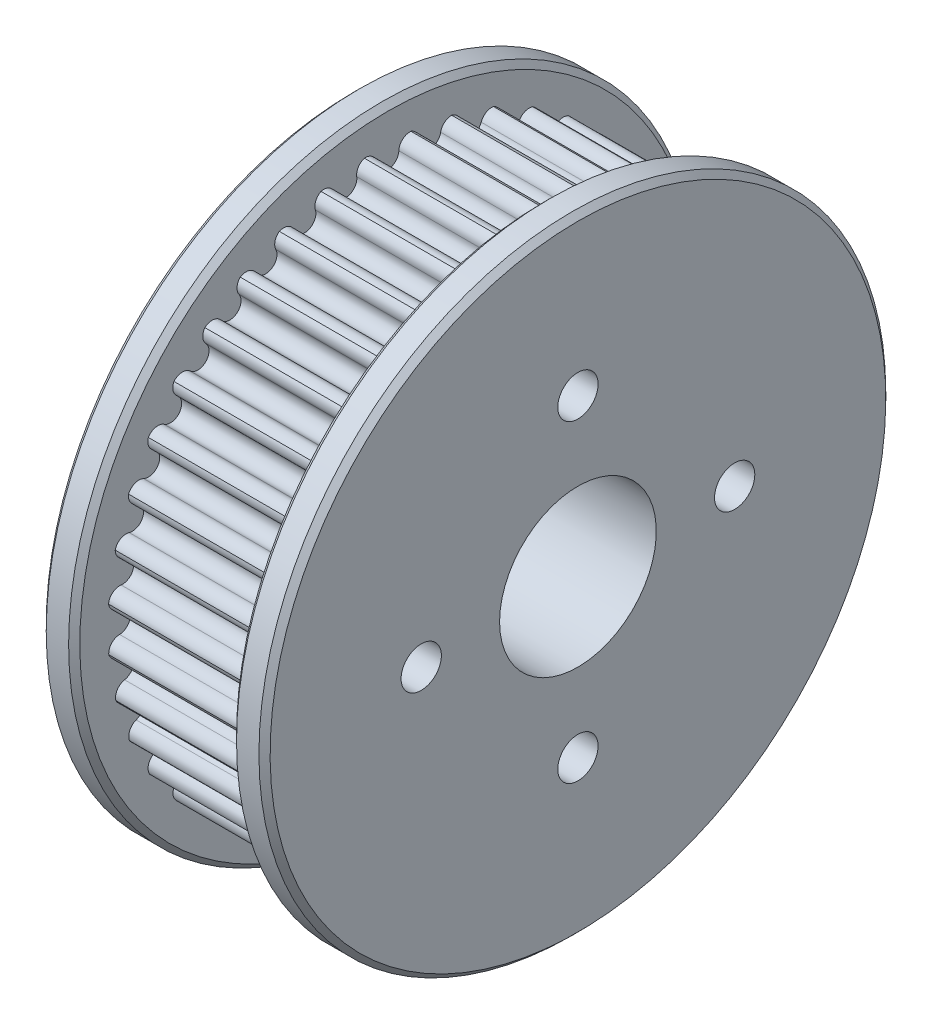
from build123d import *

# Parameters (mm, degrees)
CUT_EXTRUDE1_START       = -16.5
CUT_EXTRUDE1_OUTLINE_R   = 4
CUT_EXTRUDE1_DEPTH       = 9.5
CUT_EXTRUDE1_START_2     = -16.75
CUT_EXTRUDE1_2_OUTLINE_R = 14
CUT_EXTRUDE1_2_DEPTH     = 1
CUT_EXTRUDE1_START_3     = -8.25
CUT_EXTRUDE1_3_OUTLINE_R = 14
CUT_EXTRUDE1_3_DEPTH     = 1
SKETCH2_R                = 6.324330015
BOSS_EXTRUDE1_DEPTH      = 10
CUT_EXTRUDE2_REACH       = 24.181
SKETCH5_R                = 0.9
SKETCH6_R                = 5
BOSS_EXTRUDE3_DEPTH      = 2.75
SKETCH7_R                = 3.5
CUT_EXTRUDE3_DEPTH       = 24.549150728
FILLET1_R                = 1


with BuildPart() as part:
    # Cut-Extrude1: read off the stored shape, not the designer's step
    # Cut-Extrude1 outline → Cut-Extrude1 (new body)
    with BuildSketch(Plane(origin=(17, 0, 0), x_dir=(0, 0, -1), z_dir=(1, 0, 0)).offset(CUT_EXTRUDE1_START)):
        with BuildLine():
            ThreePointArc((1.041143378, 12.456565356), (0.66686285, 12.331604355), (0.499748821, 11.974149369))
            ThreePointArc((0.499748821, 11.974149369), (0, 11.489995997), (-0.499748821, 11.974149369))
            ThreePointArc((-0.499748821, 11.974149369), (-0.66686285, 12.331604355), (-1.041143378, 12.456565356))
            ThreePointArc((-1.041143378, 12.456565356), (-1.309730051, 12.245866404), (-1.380507466, 11.9119152))
            ThreePointArc((-1.380507466, 11.9119152), (-1.793941124, 11.349100539), (-2.366765735, 11.748549781))
            ThreePointArc((-2.366765735, 11.748549781), (-2.587740592, 12.075461509), (-2.976961313, 12.140333659))
            ThreePointArc((-2.976961313, 12.140333659), (-3.20928066, 11.890212548), (-3.226945211, 11.54930081))
            ThreePointArc((-3.226945211, 11.54930081), (-3.547245203, 10.928740058), (-4.175505021, 11.233661906))
            ThreePointArc((-4.175505021, 11.233661906), (-4.444899572, 11.521980725), (-4.83947658, 11.525166655))
            ThreePointArc((-4.83947658, 11.525166655), (-5.029808129, 11.241782197), (-4.993924854, 10.902304304))
            ThreePointArc((-4.993924854, 10.902304304), (-5.213204333, 10.239277727), (-5.881429516, 10.442163992))
            ThreePointArc((-5.881429516, 10.442163992), (-6.192610373, 10.684790536), (-6.582827873, 10.626211799))
            ThreePointArc((-6.582827873, 10.626211799), (-6.726485029, 10.31654186), (-6.637937494, 9.986856884))
            ThreePointArc((-6.637937494, 9.986856884), (-6.750797071, 9.297690396), (-7.442533697, 9.393545346))
            ThreePointArc((-7.442533697, 9.393545346), (-7.787838555, 9.584505343), (-8.164088097, 9.465604342))
            ThreePointArc((-8.164088097, 9.465604342), (-8.257533543, 9.137274024), (-8.118502082, 8.825499903))
            ThreePointArc((-8.118502082, 8.825499903), (-8.122162779, 8.127163071), (-8.820377998, 8.113626438))
            ThreePointArc((-8.820377998, 8.113626438), (-9.191304305, 8.248217819), (-9.544321376, 8.071922291))
            ThreePointArc((-9.544321376, 8.071922291), (-9.585254176, 7.733016176), (-9.399162206, 7.446829824))
            ThreePointArc((-9.399162206, 7.446829824), (-9.293533885, 6.756518017), (-9.98103532, 6.633923119))
            ThreePointArc((-9.98103532, 6.633923119), (-10.36844964, 6.708831799), (-10.689541787, 6.479482724))
            ThreePointArc((-10.689541787, 6.479482724), (-10.67695404, 6.138345804), (-10.448383761, 5.88479408))
            ThreePointArc((-10.448383761, 5.88479408), (-10.236067343, 5.219505067), (-10.895926427, 4.990870596))
            ThreePointArc((-10.895926427, 4.990870596), (-11.290289332, 5.004252074), (-11.571550203, 4.727496789))
            ThreePointArc((-11.571550203, 4.727496789), (-11.50575186, 4.392528988), (-11.240331433, 4.177855175))
            ThreePointArc((-11.240331433, 4.177855175), (-10.926554851, 3.55397058), (-11.542523663, 3.224926275))
            ThreePointArc((-11.542523663, 3.224926275), (-11.934124632, 3.176451055), (-12.16862865, 2.859104193))
            ThreePointArc((-12.16862865, 2.859104193), (-12.051239885, 2.53855353), (-11.75550484, 2.368043611))
            ThreePointArc((-11.75550484, 2.368043611), (-11.347994316, 1.800925542), (-11.90490566, 1.379573567))
            ThreePointArc((-11.90490566, 1.379573567), (-12.284102175, 1.270435269), (-12.466075073, 0.920310963))
            ThreePointArc((-12.466075073, 0.920310963), (-12.299986388, 0.622070459), (-11.981218704, 0.499922953))
            ThreePointArc((-11.981218704, 0.499922953), (-11.490008498, 0.00353574), (-11.974149369, -0.499748821))
            ThreePointArc((-11.974149369, -0.499748821), (-12.331604355, -0.66686285), (-12.456565356, -1.041143378))
            ThreePointArc((-12.456565356, -1.041143378), (-12.245866404, -1.309730051), (-11.9119152, -1.380507466))
            ThreePointArc((-11.9119152, -1.380507466), (-11.349100539, -1.793941124), (-11.748549781, -2.366765735))
            ThreePointArc((-11.748549781, -2.366765735), (-12.075461509, -2.587740592), (-12.140333659, -2.976961313))
            ThreePointArc((-12.140333659, -2.976961313), (-11.890212548, -3.20928066), (-11.54930081, -3.226945211))
            ThreePointArc((-11.54930081, -3.226945211), (-10.928740058, -3.547245203), (-11.233661906, -4.175505021))
            ThreePointArc((-11.233661906, -4.175505021), (-11.521980725, -4.444899572), (-11.525166655, -4.83947658))
            ThreePointArc((-11.525166655, -4.83947658), (-11.241782197, -5.029808129), (-10.902304304, -4.993924854))
            ThreePointArc((-10.902304304, -4.993924854), (-10.239277727, -5.213204333), (-10.442163992, -5.881429516))
            ThreePointArc((-10.442163992, -5.881429516), (-10.684790536, -6.192610373), (-10.626211799, -6.582827873))
            ThreePointArc((-10.626211799, -6.582827873), (-10.31654186, -6.726485029), (-9.986856884, -6.637937494))
            ThreePointArc((-9.986856884, -6.637937494), (-9.297690396, -6.750797071), (-9.393545346, -7.442533697))
            ThreePointArc((-9.393545346, -7.442533697), (-9.584505343, -7.787838555), (-9.465604342, -8.164088097))
            ThreePointArc((-9.465604342, -8.164088097), (-9.137274024, -8.257533543), (-8.825499903, -8.118502082))
            ThreePointArc((-8.825499903, -8.118502082), (-8.127163071, -8.122162779), (-8.113626438, -8.820377998))
            ThreePointArc((-8.113626438, -8.820377998), (-8.248217819, -9.191304305), (-8.071922291, -9.544321376))
            ThreePointArc((-8.071922291, -9.544321376), (-7.733016176, -9.585254176), (-7.446829824, -9.399162206))
            ThreePointArc((-7.446829824, -9.399162206), (-6.756518017, -9.293533885), (-6.633923119, -9.98103532))
            ThreePointArc((-6.633923119, -9.98103532), (-6.708831799, -10.36844964), (-6.479482724, -10.689541787))
            ThreePointArc((-6.479482724, -10.689541787), (-6.138345804, -10.67695404), (-5.88479408, -10.448383761))
            ThreePointArc((-5.88479408, -10.448383761), (-5.219505067, -10.236067343), (-4.990870596, -10.895926427))
            ThreePointArc((-4.990870596, -10.895926427), (-5.004252074, -11.290289332), (-4.727496789, -11.571550203))
            ThreePointArc((-4.727496789, -11.571550203), (-4.392528988, -11.50575186), (-4.177855175, -11.240331433))
            ThreePointArc((-4.177855175, -11.240331433), (-3.55397058, -10.926554851), (-3.224926275, -11.542523663))
            ThreePointArc((-3.224926275, -11.542523663), (-3.176451055, -11.934124632), (-2.859104193, -12.16862865))
            ThreePointArc((-2.859104193, -12.16862865), (-2.53855353, -12.051239885), (-2.368043611, -11.75550484))
            ThreePointArc((-2.368043611, -11.75550484), (-1.800925542, -11.347994316), (-1.379573567, -11.90490566))
            ThreePointArc((-1.379573567, -11.90490566), (-1.270435269, -12.284102175), (-0.920310963, -12.466075073))
            ThreePointArc((-0.920310963, -12.466075073), (-0.622070459, -12.299986388), (-0.499922953, -11.981218704))
            ThreePointArc((-0.499922953, -11.981218704), (-0.00353574, -11.490008498), (0.499748821, -11.974149369))
            ThreePointArc((0.499748821, -11.974149369), (0.66686285, -12.331604355), (1.041143378, -12.456565356))
            ThreePointArc((1.041143378, -12.456565356), (1.309730051, -12.245866404), (1.380507466, -11.9119152))
            ThreePointArc((1.380507466, -11.9119152), (1.793941124, -11.349100539), (2.366765735, -11.748549781))
            ThreePointArc((2.366765735, -11.748549781), (2.587740592, -12.075461509), (2.976961313, -12.140333659))
            ThreePointArc((2.976961313, -12.140333659), (3.20928066, -11.890212548), (3.226945211, -11.54930081))
            ThreePointArc((3.226945211, -11.54930081), (3.547245203, -10.928740058), (4.175505021, -11.233661906))
            ThreePointArc((4.175505021, -11.233661906), (4.444899572, -11.521980725), (4.83947658, -11.525166655))
            ThreePointArc((4.83947658, -11.525166655), (5.029808129, -11.241782197), (4.993924854, -10.902304304))
            ThreePointArc((4.993924854, -10.902304304), (5.213204333, -10.239277727), (5.881429516, -10.442163992))
            ThreePointArc((5.881429516, -10.442163992), (6.192610373, -10.684790536), (6.582827873, -10.626211799))
            ThreePointArc((6.582827873, -10.626211799), (6.726485029, -10.31654186), (6.637937494, -9.986856884))
            ThreePointArc((6.637937494, -9.986856884), (6.750797071, -9.297690396), (7.442533697, -9.393545346))
            ThreePointArc((7.442533697, -9.393545346), (7.787838555, -9.584505343), (8.164088097, -9.465604342))
            ThreePointArc((8.164088097, -9.465604342), (8.257533543, -9.137274024), (8.118502082, -8.825499903))
            ThreePointArc((8.118502082, -8.825499903), (8.122162779, -8.127163071), (8.820377998, -8.113626438))
            ThreePointArc((8.820377998, -8.113626438), (9.191304305, -8.248217819), (9.544321376, -8.071922291))
            ThreePointArc((9.544321376, -8.071922291), (9.585254176, -7.733016176), (9.399162206, -7.446829824))
            ThreePointArc((9.399162206, -7.446829824), (9.293533885, -6.756518017), (9.98103532, -6.633923119))
            ThreePointArc((9.98103532, -6.633923119), (10.36844964, -6.708831799), (10.689541787, -6.479482724))
            ThreePointArc((10.689541787, -6.479482724), (10.67695404, -6.138345804), (10.448383761, -5.88479408))
            ThreePointArc((10.448383761, -5.88479408), (10.236067343, -5.219505067), (10.895926427, -4.990870596))
            ThreePointArc((10.895926427, -4.990870596), (11.290289332, -5.004252074), (11.571550203, -4.727496789))
            ThreePointArc((11.571550203, -4.727496789), (11.50575186, -4.392528988), (11.240331433, -4.177855175))
            ThreePointArc((11.240331433, -4.177855175), (10.926554851, -3.55397058), (11.542523663, -3.224926275))
            ThreePointArc((11.542523663, -3.224926275), (11.934124632, -3.176451055), (12.16862865, -2.859104193))
            ThreePointArc((12.16862865, -2.859104193), (12.051239885, -2.53855353), (11.75550484, -2.368043611))
            ThreePointArc((11.75550484, -2.368043611), (11.347994316, -1.800925542), (11.90490566, -1.379573567))
            ThreePointArc((11.90490566, -1.379573567), (12.284102175, -1.270435269), (12.466075073, -0.920310963))
            ThreePointArc((12.466075073, -0.920310963), (12.299986388, -0.622070459), (11.981218704, -0.499922953))
            ThreePointArc((11.981218704, -0.499922953), (11.490008498, -0.00353574), (11.974149369, 0.499748821))
            ThreePointArc((11.974149369, 0.499748821), (12.331604355, 0.66686285), (12.456565356, 1.041143378))
            ThreePointArc((12.456565356, 1.041143378), (12.245866404, 1.309730051), (11.9119152, 1.380507466))
            ThreePointArc((11.9119152, 1.380507466), (11.349100539, 1.793941124), (11.748549781, 2.366765735))
            ThreePointArc((11.748549781, 2.366765735), (12.075461509, 2.587740592), (12.140333659, 2.976961313))
            ThreePointArc((12.140333659, 2.976961313), (11.890212548, 3.20928066), (11.54930081, 3.226945211))
            ThreePointArc((11.54930081, 3.226945211), (10.928740058, 3.547245203), (11.233661906, 4.175505021))
            ThreePointArc((11.233661906, 4.175505021), (11.521980725, 4.444899572), (11.525166655, 4.83947658))
            ThreePointArc((11.525166655, 4.83947658), (11.241782197, 5.029808129), (10.902304304, 4.993924854))
            ThreePointArc((10.902304304, 4.993924854), (10.239277727, 5.213204333), (10.442163992, 5.881429516))
            ThreePointArc((10.442163992, 5.881429516), (10.684790536, 6.192610373), (10.626211799, 6.582827873))
            ThreePointArc((10.626211799, 6.582827873), (10.31654186, 6.726485029), (9.986856884, 6.637937494))
            ThreePointArc((9.986856884, 6.637937494), (9.297690396, 6.750797071), (9.393545346, 7.442533697))
            ThreePointArc((9.393545346, 7.442533697), (9.584505343, 7.787838555), (9.465604342, 8.164088097))
            ThreePointArc((9.465604342, 8.164088097), (9.137274024, 8.257533543), (8.825499903, 8.118502082))
            ThreePointArc((8.825499903, 8.118502082), (8.127163071, 8.122162779), (8.113626438, 8.820377998))
            ThreePointArc((8.113626438, 8.820377998), (8.248217819, 9.191304305), (8.071922291, 9.544321376))
            ThreePointArc((8.071922291, 9.544321376), (7.733016176, 9.585254176), (7.446829824, 9.399162206))
            ThreePointArc((7.446829824, 9.399162206), (6.756518017, 9.293533885), (6.633923119, 9.98103532))
            ThreePointArc((6.633923119, 9.98103532), (6.708831799, 10.36844964), (6.479482724, 10.689541787))
            ThreePointArc((6.479482724, 10.689541787), (6.138345804, 10.67695404), (5.88479408, 10.448383761))
            ThreePointArc((5.88479408, 10.448383761), (5.219505067, 10.236067343), (4.990870596, 10.895926427))
            ThreePointArc((4.990870596, 10.895926427), (5.004252074, 11.290289332), (4.727496789, 11.571550203))
            ThreePointArc((4.727496789, 11.571550203), (4.392528988, 11.50575186), (4.177855175, 11.240331433))
            ThreePointArc((4.177855175, 11.240331433), (3.55397058, 10.926554851), (3.224926275, 11.542523663))
            ThreePointArc((3.224926275, 11.542523663), (3.176451055, 11.934124632), (2.859104193, 12.16862865))
            ThreePointArc((2.859104193, 12.16862865), (2.53855353, 12.051239885), (2.368043611, 11.75550484))
            ThreePointArc((2.368043611, 11.75550484), (1.797431377, 11.34853508), (1.380507466, 11.9119152))
            ThreePointArc((1.380507466, 11.9119152), (1.309730051, 12.245866404), (1.041143378, 12.456565356))
        make_face()
        Circle(CUT_EXTRUDE1_OUTLINE_R, mode=Mode.SUBTRACT)
    extrude(amount=CUT_EXTRUDE1_DEPTH)

    # Cut-Extrude1 2 outline → Cut-Extrude1 2 (add)
    with BuildSketch(Plane(origin=(17, 0, 0), x_dir=(0, 0, -1), z_dir=(1, 0, 0)).offset(CUT_EXTRUDE1_START_2)):
        Circle(CUT_EXTRUDE1_2_OUTLINE_R)
        with BuildLine():
            ThreePointArc((-0.499748821, 11.974149369), (0, 11.489995997), (0.499748821, 11.974149369))
            ThreePointArc((0.499748821, 11.974149369), (0.66686285, 12.331604355), (1.041143378, 12.456565356))
            ThreePointArc((1.041143378, 12.456565356), (1.309730051, 12.245866404), (1.380507466, 11.9119152))
            ThreePointArc((1.380507466, 11.9119152), (1.797431377, 11.34853508), (2.368043611, 11.75550484))
            ThreePointArc((2.368043611, 11.75550484), (2.53855353, 12.051239885), (2.859104193, 12.16862865))
            ThreePointArc((2.859104193, 12.16862865), (3.176451055, 11.934124632), (3.224926275, 11.542523663))
            ThreePointArc((3.224926275, 11.542523663), (3.55397058, 10.926554851), (4.177855175, 11.240331433))
            ThreePointArc((4.177855175, 11.240331433), (4.392528988, 11.50575186), (4.727496789, 11.571550204))
            ThreePointArc((4.727496789, 11.571550204), (5.004252074, 11.290289332), (4.990870596, 10.895926427))
            ThreePointArc((4.990870596, 10.895926427), (5.219505067, 10.236067343), (5.88479408, 10.448383761))
            ThreePointArc((5.88479408, 10.448383761), (6.138345804, 10.67695404), (6.479482724, 10.689541788))
            ThreePointArc((6.479482724, 10.689541788), (6.708831799, 10.36844964), (6.633923119, 9.98103532))
            ThreePointArc((6.633923119, 9.98103532), (6.756518017, 9.293533885), (7.446829824, 9.399162206))
            ThreePointArc((7.446829824, 9.399162206), (7.733016176, 9.585254176), (8.071922291, 9.544321376))
            ThreePointArc((8.071922291, 9.544321376), (8.248217819, 9.191304305), (8.113626438, 8.820377998))
            ThreePointArc((8.113626438, 8.820377998), (8.127163071, 8.122162779), (8.825499903, 8.118502082))
            ThreePointArc((8.825499903, 8.118502082), (9.137274024, 8.257533543), (9.465604342, 8.164088097))
            ThreePointArc((9.465604342, 8.164088097), (9.584505343, 7.787838555), (9.393545346, 7.442533697))
            ThreePointArc((9.393545346, 7.442533697), (9.297690396, 6.750797071), (9.986856884, 6.637937494))
            ThreePointArc((9.986856884, 6.637937494), (10.31654186, 6.726485029), (10.626211799, 6.582827873))
            ThreePointArc((10.626211799, 6.582827873), (10.684790536, 6.192610373), (10.442163992, 5.881429516))
            ThreePointArc((10.442163992, 5.881429516), (10.239277727, 5.213204333), (10.902304304, 4.993924854))
            ThreePointArc((10.902304304, 4.993924854), (11.241782197, 5.029808129), (11.525166655, 4.83947658))
            ThreePointArc((11.525166655, 4.83947658), (11.521980725, 4.444899572), (11.233661906, 4.175505021))
            ThreePointArc((11.233661906, 4.175505021), (10.928740058, 3.547245203), (11.54930081, 3.226945211))
            ThreePointArc((11.54930081, 3.226945211), (11.890212548, 3.20928066), (12.140333659, 2.976961313))
            ThreePointArc((12.140333659, 2.976961313), (12.075461509, 2.587740592), (11.748549781, 2.366765735))
            ThreePointArc((11.748549781, 2.366765735), (11.349100539, 1.793941124), (11.9119152, 1.380507466))
            ThreePointArc((11.9119152, 1.380507466), (12.245866404, 1.309730051), (12.456565356, 1.041143378))
            ThreePointArc((12.456565356, 1.041143378), (12.331604355, 0.66686285), (11.974149369, 0.499748821))
            ThreePointArc((11.974149369, 0.499748821), (11.490008498, -0.00353574), (11.981218704, -0.499922953))
            ThreePointArc((11.981218704, -0.499922953), (12.299986388, -0.622070459), (12.466075073, -0.920310963))
            ThreePointArc((12.466075073, -0.920310963), (12.284102175, -1.270435269), (11.90490566, -1.379573567))
            ThreePointArc((11.90490566, -1.379573567), (11.347994316, -1.800925542), (11.75550484, -2.368043611))
            ThreePointArc((11.75550484, -2.368043611), (12.051239885, -2.53855353), (12.16862865, -2.859104193))
            ThreePointArc((12.16862865, -2.859104193), (11.934124632, -3.176451055), (11.542523663, -3.224926275))
            ThreePointArc((11.542523663, -3.224926275), (10.926554851, -3.55397058), (11.240331433, -4.177855175))
            ThreePointArc((11.240331433, -4.177855175), (11.50575186, -4.392528988), (11.571550204, -4.727496789))
            ThreePointArc((11.571550204, -4.727496789), (11.290289332, -5.004252074), (10.895926427, -4.990870596))
            ThreePointArc((10.895926427, -4.990870596), (10.236067343, -5.219505067), (10.448383761, -5.88479408))
            ThreePointArc((10.448383761, -5.88479408), (10.67695404, -6.138345804), (10.689541788, -6.479482724))
            ThreePointArc((10.689541788, -6.479482724), (10.36844964, -6.708831799), (9.98103532, -6.633923119))
            ThreePointArc((9.98103532, -6.633923119), (9.293533885, -6.756518017), (9.399162206, -7.446829824))
            ThreePointArc((9.399162206, -7.446829824), (9.585254176, -7.733016176), (9.544321376, -8.071922291))
            ThreePointArc((9.544321376, -8.071922291), (9.191304305, -8.248217819), (8.820377998, -8.113626438))
            ThreePointArc((8.820377998, -8.113626438), (8.122162779, -8.127163071), (8.118502082, -8.825499903))
            ThreePointArc((8.118502082, -8.825499903), (8.257533543, -9.137274024), (8.164088097, -9.465604342))
            ThreePointArc((8.164088097, -9.465604342), (7.787838555, -9.584505343), (7.442533697, -9.393545346))
            ThreePointArc((7.442533697, -9.393545346), (6.750797071, -9.297690396), (6.637937494, -9.986856884))
            ThreePointArc((6.637937494, -9.986856884), (6.726485029, -10.31654186), (6.582827873, -10.626211799))
            ThreePointArc((6.582827873, -10.626211799), (6.192610373, -10.684790536), (5.881429516, -10.442163992))
            ThreePointArc((5.881429516, -10.442163992), (5.213204333, -10.239277727), (4.993924854, -10.902304304))
            ThreePointArc((4.993924854, -10.902304304), (5.029808129, -11.241782197), (4.83947658, -11.525166655))
            ThreePointArc((4.83947658, -11.525166655), (4.444899572, -11.521980725), (4.175505021, -11.233661906))
            ThreePointArc((4.175505021, -11.233661906), (3.547245203, -10.928740058), (3.226945211, -11.54930081))
            ThreePointArc((3.226945211, -11.54930081), (3.20928066, -11.890212548), (2.976961313, -12.140333659))
            ThreePointArc((2.976961313, -12.140333659), (2.587740592, -12.075461509), (2.366765735, -11.748549781))
            ThreePointArc((2.366765735, -11.748549781), (1.793941124, -11.349100539), (1.380507466, -11.9119152))
            ThreePointArc((1.380507466, -11.9119152), (1.309730051, -12.245866404), (1.041143378, -12.456565356))
            ThreePointArc((1.041143378, -12.456565356), (0.66686285, -12.331604355), (0.499748821, -11.974149369))
            ThreePointArc((0.499748821, -11.974149369), (-0.00353574, -11.490008498), (-0.499922953, -11.981218704))
            ThreePointArc((-0.499922953, -11.981218704), (-0.622070459, -12.299986388), (-0.920310963, -12.466075073))
            ThreePointArc((-0.920310963, -12.466075073), (-1.270435269, -12.284102175), (-1.379573567, -11.90490566))
            ThreePointArc((-1.379573567, -11.90490566), (-1.800925542, -11.347994316), (-2.368043611, -11.75550484))
            ThreePointArc((-2.368043611, -11.75550484), (-2.53855353, -12.051239885), (-2.859104193, -12.16862865))
            ThreePointArc((-2.859104193, -12.16862865), (-3.176451055, -11.934124632), (-3.224926275, -11.542523663))
            ThreePointArc((-3.224926275, -11.542523663), (-3.55397058, -10.926554851), (-4.177855175, -11.240331433))
            ThreePointArc((-4.177855175, -11.240331433), (-4.392528988, -11.50575186), (-4.727496789, -11.571550204))
            ThreePointArc((-4.727496789, -11.571550204), (-5.004252074, -11.290289332), (-4.990870596, -10.895926427))
            ThreePointArc((-4.990870596, -10.895926427), (-5.219505067, -10.236067343), (-5.88479408, -10.448383761))
            ThreePointArc((-5.88479408, -10.448383761), (-6.138345804, -10.67695404), (-6.479482724, -10.689541788))
            ThreePointArc((-6.479482724, -10.689541788), (-6.708831799, -10.36844964), (-6.633923119, -9.98103532))
            ThreePointArc((-6.633923119, -9.98103532), (-6.756518017, -9.293533885), (-7.446829824, -9.399162206))
            ThreePointArc((-7.446829824, -9.399162206), (-7.733016176, -9.585254176), (-8.071922291, -9.544321376))
            ThreePointArc((-8.071922291, -9.544321376), (-8.248217819, -9.191304305), (-8.113626438, -8.820377998))
            ThreePointArc((-8.113626438, -8.820377998), (-8.127163071, -8.122162779), (-8.825499903, -8.118502082))
            ThreePointArc((-8.825499903, -8.118502082), (-9.137274024, -8.257533543), (-9.465604342, -8.164088097))
            ThreePointArc((-9.465604342, -8.164088097), (-9.584505343, -7.787838555), (-9.393545346, -7.442533697))
            ThreePointArc((-9.393545346, -7.442533697), (-9.297690396, -6.750797071), (-9.986856884, -6.637937494))
            ThreePointArc((-9.986856884, -6.637937494), (-10.31654186, -6.726485029), (-10.626211799, -6.582827873))
            ThreePointArc((-10.626211799, -6.582827873), (-10.684790536, -6.192610373), (-10.442163992, -5.881429516))
            ThreePointArc((-10.442163992, -5.881429516), (-10.239277727, -5.213204333), (-10.902304304, -4.993924854))
            ThreePointArc((-10.902304304, -4.993924854), (-11.241782197, -5.029808129), (-11.525166655, -4.83947658))
            ThreePointArc((-11.525166655, -4.83947658), (-11.521980725, -4.444899572), (-11.233661906, -4.175505021))
            ThreePointArc((-11.233661906, -4.175505021), (-10.928740058, -3.547245203), (-11.54930081, -3.226945211))
            ThreePointArc((-11.54930081, -3.226945211), (-11.890212548, -3.20928066), (-12.140333659, -2.976961313))
            ThreePointArc((-12.140333659, -2.976961313), (-12.075461509, -2.587740592), (-11.748549781, -2.366765735))
            ThreePointArc((-11.748549781, -2.366765735), (-11.349100539, -1.793941124), (-11.9119152, -1.380507466))
            ThreePointArc((-11.9119152, -1.380507466), (-12.245866404, -1.309730051), (-12.456565356, -1.041143378))
            ThreePointArc((-12.456565356, -1.041143378), (-12.331604355, -0.66686285), (-11.974149369, -0.499748821))
            ThreePointArc((-11.974149369, -0.499748821), (-11.490008498, 0.00353574), (-11.981218704, 0.499922953))
            ThreePointArc((-11.981218704, 0.499922953), (-12.299986388, 0.622070459), (-12.466075073, 0.920310963))
            ThreePointArc((-12.466075073, 0.920310963), (-12.284102175, 1.270435269), (-11.90490566, 1.379573567))
            ThreePointArc((-11.90490566, 1.379573567), (-11.347994316, 1.800925542), (-11.75550484, 2.368043611))
            ThreePointArc((-11.75550484, 2.368043611), (-12.051239885, 2.53855353), (-12.16862865, 2.859104193))
            ThreePointArc((-12.16862865, 2.859104193), (-11.934124632, 3.176451055), (-11.542523663, 3.224926275))
            ThreePointArc((-11.542523663, 3.224926275), (-10.926554851, 3.55397058), (-11.240331433, 4.177855175))
            ThreePointArc((-11.240331433, 4.177855175), (-11.50575186, 4.392528988), (-11.571550204, 4.727496789))
            ThreePointArc((-11.571550204, 4.727496789), (-11.290289332, 5.004252074), (-10.895926427, 4.990870596))
            ThreePointArc((-10.895926427, 4.990870596), (-10.236067343, 5.219505067), (-10.448383761, 5.88479408))
            ThreePointArc((-10.448383761, 5.88479408), (-10.67695404, 6.138345804), (-10.689541788, 6.479482724))
            ThreePointArc((-10.689541788, 6.479482724), (-10.36844964, 6.708831799), (-9.98103532, 6.633923119))
            ThreePointArc((-9.98103532, 6.633923119), (-9.293533885, 6.756518017), (-9.399162206, 7.446829824))
            ThreePointArc((-9.399162206, 7.446829824), (-9.585254176, 7.733016176), (-9.544321376, 8.071922291))
            ThreePointArc((-9.544321376, 8.071922291), (-9.191304305, 8.248217819), (-8.820377998, 8.113626438))
            ThreePointArc((-8.820377998, 8.113626438), (-8.122162779, 8.127163071), (-8.118502082, 8.825499903))
            ThreePointArc((-8.118502082, 8.825499903), (-8.257533543, 9.137274024), (-8.164088097, 9.465604342))
            ThreePointArc((-8.164088097, 9.465604342), (-7.787838555, 9.584505343), (-7.442533697, 9.393545346))
            ThreePointArc((-7.442533697, 9.393545346), (-6.750797071, 9.297690396), (-6.637937494, 9.986856884))
            ThreePointArc((-6.637937494, 9.986856884), (-6.726485029, 10.31654186), (-6.582827873, 10.626211799))
            ThreePointArc((-6.582827873, 10.626211799), (-6.192610373, 10.684790536), (-5.881429516, 10.442163992))
            ThreePointArc((-5.881429516, 10.442163992), (-5.213204333, 10.239277727), (-4.993924854, 10.902304304))
            ThreePointArc((-4.993924854, 10.902304304), (-5.029808129, 11.241782197), (-4.83947658, 11.525166655))
            ThreePointArc((-4.83947658, 11.525166655), (-4.444899572, 11.521980725), (-4.175505021, 11.233661906))
            ThreePointArc((-4.175505021, 11.233661906), (-3.547245203, 10.928740058), (-3.226945211, 11.54930081))
            ThreePointArc((-3.226945211, 11.54930081), (-3.20928066, 11.890212548), (-2.976961313, 12.140333659))
            ThreePointArc((-2.976961313, 12.140333659), (-2.587740592, 12.075461509), (-2.366765735, 11.748549781))
            ThreePointArc((-2.366765735, 11.748549781), (-1.793941124, 11.349100539), (-1.380507466, 11.9119152))
            ThreePointArc((-1.380507466, 11.9119152), (-1.309730051, 12.245866404), (-1.041143378, 12.456565356))
            ThreePointArc((-1.041143378, 12.456565356), (-0.66686285, 12.331604355), (-0.499748821, 11.974149369))
        make_face(mode=Mode.SUBTRACT)
    extrude(amount=CUT_EXTRUDE1_2_DEPTH)

    # Cut-Extrude1 3 outline → Cut-Extrude1 3 (add)
    with BuildSketch(Plane(origin=(17, 0, 0), x_dir=(0, 0, -1), z_dir=(1, 0, 0)).offset(CUT_EXTRUDE1_START_3)):
        Circle(CUT_EXTRUDE1_3_OUTLINE_R)
        with BuildLine():
            ThreePointArc((-0.499748821, 11.974149369), (0, 11.489995997), (0.499748821, 11.974149369))
            ThreePointArc((0.499748821, 11.974149369), (0.66686285, 12.331604355), (1.041143378, 12.456565356))
            ThreePointArc((1.041143378, 12.456565356), (1.309730051, 12.245866404), (1.380507466, 11.9119152))
            ThreePointArc((1.380507466, 11.9119152), (1.797431377, 11.34853508), (2.368043611, 11.75550484))
            ThreePointArc((2.368043611, 11.75550484), (2.53855353, 12.051239885), (2.859104193, 12.16862865))
            ThreePointArc((2.859104193, 12.16862865), (3.176451055, 11.934124632), (3.224926275, 11.542523663))
            ThreePointArc((3.224926275, 11.542523663), (3.55397058, 10.926554851), (4.177855175, 11.240331433))
            ThreePointArc((4.177855175, 11.240331433), (4.392528988, 11.50575186), (4.727496789, 11.571550204))
            ThreePointArc((4.727496789, 11.571550204), (5.004252074, 11.290289332), (4.990870596, 10.895926427))
            ThreePointArc((4.990870596, 10.895926427), (5.219505067, 10.236067343), (5.88479408, 10.448383761))
            ThreePointArc((5.88479408, 10.448383761), (6.138345804, 10.67695404), (6.479482724, 10.689541788))
            ThreePointArc((6.479482724, 10.689541788), (6.708831799, 10.36844964), (6.633923119, 9.98103532))
            ThreePointArc((6.633923119, 9.98103532), (6.756518017, 9.293533885), (7.446829824, 9.399162206))
            ThreePointArc((7.446829824, 9.399162206), (7.733016176, 9.585254176), (8.071922291, 9.544321376))
            ThreePointArc((8.071922291, 9.544321376), (8.248217819, 9.191304305), (8.113626438, 8.820377998))
            ThreePointArc((8.113626438, 8.820377998), (8.127163071, 8.122162779), (8.825499903, 8.118502082))
            ThreePointArc((8.825499903, 8.118502082), (9.137274024, 8.257533543), (9.465604342, 8.164088097))
            ThreePointArc((9.465604342, 8.164088097), (9.584505343, 7.787838555), (9.393545346, 7.442533697))
            ThreePointArc((9.393545346, 7.442533697), (9.297690396, 6.750797071), (9.986856884, 6.637937494))
            ThreePointArc((9.986856884, 6.637937494), (10.31654186, 6.726485029), (10.626211799, 6.582827873))
            ThreePointArc((10.626211799, 6.582827873), (10.684790536, 6.192610373), (10.442163992, 5.881429516))
            ThreePointArc((10.442163992, 5.881429516), (10.239277727, 5.213204333), (10.902304304, 4.993924854))
            ThreePointArc((10.902304304, 4.993924854), (11.241782197, 5.029808129), (11.525166655, 4.83947658))
            ThreePointArc((11.525166655, 4.83947658), (11.521980725, 4.444899572), (11.233661906, 4.175505021))
            ThreePointArc((11.233661906, 4.175505021), (10.928740058, 3.547245203), (11.54930081, 3.226945211))
            ThreePointArc((11.54930081, 3.226945211), (11.890212548, 3.20928066), (12.140333659, 2.976961313))
            ThreePointArc((12.140333659, 2.976961313), (12.075461509, 2.587740592), (11.748549781, 2.366765735))
            ThreePointArc((11.748549781, 2.366765735), (11.349100539, 1.793941124), (11.9119152, 1.380507466))
            ThreePointArc((11.9119152, 1.380507466), (12.245866404, 1.309730051), (12.456565356, 1.041143378))
            ThreePointArc((12.456565356, 1.041143378), (12.331604355, 0.66686285), (11.974149369, 0.499748821))
            ThreePointArc((11.974149369, 0.499748821), (11.490008498, -0.00353574), (11.981218704, -0.499922953))
            ThreePointArc((11.981218704, -0.499922953), (12.299986388, -0.622070459), (12.466075073, -0.920310963))
            ThreePointArc((12.466075073, -0.920310963), (12.284102175, -1.270435269), (11.90490566, -1.379573567))
            ThreePointArc((11.90490566, -1.379573567), (11.347994316, -1.800925542), (11.75550484, -2.368043611))
            ThreePointArc((11.75550484, -2.368043611), (12.051239885, -2.53855353), (12.16862865, -2.859104193))
            ThreePointArc((12.16862865, -2.859104193), (11.934124632, -3.176451055), (11.542523663, -3.224926275))
            ThreePointArc((11.542523663, -3.224926275), (10.926554851, -3.55397058), (11.240331433, -4.177855175))
            ThreePointArc((11.240331433, -4.177855175), (11.50575186, -4.392528988), (11.571550204, -4.727496789))
            ThreePointArc((11.571550204, -4.727496789), (11.290289332, -5.004252074), (10.895926427, -4.990870596))
            ThreePointArc((10.895926427, -4.990870596), (10.236067343, -5.219505067), (10.448383761, -5.88479408))
            ThreePointArc((10.448383761, -5.88479408), (10.67695404, -6.138345804), (10.689541788, -6.479482724))
            ThreePointArc((10.689541788, -6.479482724), (10.36844964, -6.708831799), (9.98103532, -6.633923119))
            ThreePointArc((9.98103532, -6.633923119), (9.293533885, -6.756518017), (9.399162206, -7.446829824))
            ThreePointArc((9.399162206, -7.446829824), (9.585254176, -7.733016176), (9.544321376, -8.071922291))
            ThreePointArc((9.544321376, -8.071922291), (9.191304305, -8.248217819), (8.820377998, -8.113626438))
            ThreePointArc((8.820377998, -8.113626438), (8.122162779, -8.127163071), (8.118502082, -8.825499903))
            ThreePointArc((8.118502082, -8.825499903), (8.257533543, -9.137274024), (8.164088097, -9.465604342))
            ThreePointArc((8.164088097, -9.465604342), (7.787838555, -9.584505343), (7.442533697, -9.393545346))
            ThreePointArc((7.442533697, -9.393545346), (6.750797071, -9.297690396), (6.637937494, -9.986856884))
            ThreePointArc((6.637937494, -9.986856884), (6.726485029, -10.31654186), (6.582827873, -10.626211799))
            ThreePointArc((6.582827873, -10.626211799), (6.192610373, -10.684790536), (5.881429516, -10.442163992))
            ThreePointArc((5.881429516, -10.442163992), (5.213204333, -10.239277727), (4.993924854, -10.902304304))
            ThreePointArc((4.993924854, -10.902304304), (5.029808129, -11.241782197), (4.83947658, -11.525166655))
            ThreePointArc((4.83947658, -11.525166655), (4.444899572, -11.521980725), (4.175505021, -11.233661906))
            ThreePointArc((4.175505021, -11.233661906), (3.547245203, -10.928740058), (3.226945211, -11.54930081))
            ThreePointArc((3.226945211, -11.54930081), (3.20928066, -11.890212548), (2.976961313, -12.140333659))
            ThreePointArc((2.976961313, -12.140333659), (2.587740592, -12.075461509), (2.366765735, -11.748549781))
            ThreePointArc((2.366765735, -11.748549781), (1.793941124, -11.349100539), (1.380507466, -11.9119152))
            ThreePointArc((1.380507466, -11.9119152), (1.309730051, -12.245866404), (1.041143378, -12.456565356))
            ThreePointArc((1.041143378, -12.456565356), (0.66686285, -12.331604355), (0.499748821, -11.974149369))
            ThreePointArc((0.499748821, -11.974149369), (-0.00353574, -11.490008498), (-0.499922953, -11.981218704))
            ThreePointArc((-0.499922953, -11.981218704), (-0.622070459, -12.299986388), (-0.920310963, -12.466075073))
            ThreePointArc((-0.920310963, -12.466075073), (-1.270435269, -12.284102175), (-1.379573567, -11.90490566))
            ThreePointArc((-1.379573567, -11.90490566), (-1.800925542, -11.347994316), (-2.368043611, -11.75550484))
            ThreePointArc((-2.368043611, -11.75550484), (-2.53855353, -12.051239885), (-2.859104193, -12.16862865))
            ThreePointArc((-2.859104193, -12.16862865), (-3.176451055, -11.934124632), (-3.224926275, -11.542523663))
            ThreePointArc((-3.224926275, -11.542523663), (-3.55397058, -10.926554851), (-4.177855175, -11.240331433))
            ThreePointArc((-4.177855175, -11.240331433), (-4.392528988, -11.50575186), (-4.727496789, -11.571550204))
            ThreePointArc((-4.727496789, -11.571550204), (-5.004252074, -11.290289332), (-4.990870596, -10.895926427))
            ThreePointArc((-4.990870596, -10.895926427), (-5.219505067, -10.236067343), (-5.88479408, -10.448383761))
            ThreePointArc((-5.88479408, -10.448383761), (-6.138345804, -10.67695404), (-6.479482724, -10.689541788))
            ThreePointArc((-6.479482724, -10.689541788), (-6.708831799, -10.36844964), (-6.633923119, -9.98103532))
            ThreePointArc((-6.633923119, -9.98103532), (-6.756518017, -9.293533885), (-7.446829824, -9.399162206))
            ThreePointArc((-7.446829824, -9.399162206), (-7.733016176, -9.585254176), (-8.071922291, -9.544321376))
            ThreePointArc((-8.071922291, -9.544321376), (-8.248217819, -9.191304305), (-8.113626438, -8.820377998))
            ThreePointArc((-8.113626438, -8.820377998), (-8.127163071, -8.122162779), (-8.825499903, -8.118502082))
            ThreePointArc((-8.825499903, -8.118502082), (-9.137274024, -8.257533543), (-9.465604342, -8.164088097))
            ThreePointArc((-9.465604342, -8.164088097), (-9.584505343, -7.787838555), (-9.393545346, -7.442533697))
            ThreePointArc((-9.393545346, -7.442533697), (-9.297690396, -6.750797071), (-9.986856884, -6.637937494))
            ThreePointArc((-9.986856884, -6.637937494), (-10.31654186, -6.726485029), (-10.626211799, -6.582827873))
            ThreePointArc((-10.626211799, -6.582827873), (-10.684790536, -6.192610373), (-10.442163992, -5.881429516))
            ThreePointArc((-10.442163992, -5.881429516), (-10.239277727, -5.213204333), (-10.902304304, -4.993924854))
            ThreePointArc((-10.902304304, -4.993924854), (-11.241782197, -5.029808129), (-11.525166655, -4.83947658))
            ThreePointArc((-11.525166655, -4.83947658), (-11.521980725, -4.444899572), (-11.233661906, -4.175505021))
            ThreePointArc((-11.233661906, -4.175505021), (-10.928740058, -3.547245203), (-11.54930081, -3.226945211))
            ThreePointArc((-11.54930081, -3.226945211), (-11.890212548, -3.20928066), (-12.140333659, -2.976961313))
            ThreePointArc((-12.140333659, -2.976961313), (-12.075461509, -2.587740592), (-11.748549781, -2.366765735))
            ThreePointArc((-11.748549781, -2.366765735), (-11.349100539, -1.793941124), (-11.9119152, -1.380507466))
            ThreePointArc((-11.9119152, -1.380507466), (-12.245866404, -1.309730051), (-12.456565356, -1.041143378))
            ThreePointArc((-12.456565356, -1.041143378), (-12.331604355, -0.66686285), (-11.974149369, -0.499748821))
            ThreePointArc((-11.974149369, -0.499748821), (-11.490008498, 0.00353574), (-11.981218704, 0.499922953))
            ThreePointArc((-11.981218704, 0.499922953), (-12.299986388, 0.622070459), (-12.466075073, 0.920310963))
            ThreePointArc((-12.466075073, 0.920310963), (-12.284102175, 1.270435269), (-11.90490566, 1.379573567))
            ThreePointArc((-11.90490566, 1.379573567), (-11.347994316, 1.800925542), (-11.75550484, 2.368043611))
            ThreePointArc((-11.75550484, 2.368043611), (-12.051239885, 2.53855353), (-12.16862865, 2.859104193))
            ThreePointArc((-12.16862865, 2.859104193), (-11.934124632, 3.176451055), (-11.542523663, 3.224926275))
            ThreePointArc((-11.542523663, 3.224926275), (-10.926554851, 3.55397058), (-11.240331433, 4.177855175))
            ThreePointArc((-11.240331433, 4.177855175), (-11.50575186, 4.392528988), (-11.571550204, 4.727496789))
            ThreePointArc((-11.571550204, 4.727496789), (-11.290289332, 5.004252074), (-10.895926427, 4.990870596))
            ThreePointArc((-10.895926427, 4.990870596), (-10.236067343, 5.219505067), (-10.448383761, 5.88479408))
            ThreePointArc((-10.448383761, 5.88479408), (-10.67695404, 6.138345804), (-10.689541788, 6.479482724))
            ThreePointArc((-10.689541788, 6.479482724), (-10.36844964, 6.708831799), (-9.98103532, 6.633923119))
            ThreePointArc((-9.98103532, 6.633923119), (-9.293533885, 6.756518017), (-9.399162206, 7.446829824))
            ThreePointArc((-9.399162206, 7.446829824), (-9.585254176, 7.733016176), (-9.544321376, 8.071922291))
            ThreePointArc((-9.544321376, 8.071922291), (-9.191304305, 8.248217819), (-8.820377998, 8.113626438))
            ThreePointArc((-8.820377998, 8.113626438), (-8.122162779, 8.127163071), (-8.118502082, 8.825499903))
            ThreePointArc((-8.118502082, 8.825499903), (-8.257533543, 9.137274024), (-8.164088097, 9.465604342))
            ThreePointArc((-8.164088097, 9.465604342), (-7.787838555, 9.584505343), (-7.442533697, 9.393545346))
            ThreePointArc((-7.442533697, 9.393545346), (-6.750797071, 9.297690396), (-6.637937494, 9.986856884))
            ThreePointArc((-6.637937494, 9.986856884), (-6.726485029, 10.31654186), (-6.582827873, 10.626211799))
            ThreePointArc((-6.582827873, 10.626211799), (-6.192610373, 10.684790536), (-5.881429516, 10.442163992))
            ThreePointArc((-5.881429516, 10.442163992), (-5.213204333, 10.239277727), (-4.993924854, 10.902304304))
            ThreePointArc((-4.993924854, 10.902304304), (-5.029808129, 11.241782197), (-4.83947658, 11.525166655))
            ThreePointArc((-4.83947658, 11.525166655), (-4.444899572, 11.521980725), (-4.175505021, 11.233661906))
            ThreePointArc((-4.175505021, 11.233661906), (-3.547245203, 10.928740058), (-3.226945211, 11.54930081))
            ThreePointArc((-3.226945211, 11.54930081), (-3.20928066, 11.890212548), (-2.976961313, 12.140333659))
            ThreePointArc((-2.976961313, 12.140333659), (-2.587740592, 12.075461509), (-2.366765735, 11.748549781))
            ThreePointArc((-2.366765735, 11.748549781), (-1.793941124, 11.349100539), (-1.380507466, 11.9119152))
            ThreePointArc((-1.380507466, 11.9119152), (-1.309730051, 12.245866404), (-1.041143378, 12.456565356))
            ThreePointArc((-1.041143378, 12.456565356), (-0.66686285, 12.331604355), (-0.499748821, 11.974149369))
        make_face(mode=Mode.SUBTRACT)
    extrude(amount=CUT_EXTRUDE1_3_DEPTH)

    # Cut-Extrude1 4 outline → Cut-Extrude1 4 (revolve)
    with BuildSketch(Plane.YX):
        Polygon((4, 0.5), (4.5, 0), (13.75, 0), (14, 0.25), (12.500000001, 0.25), (12.500000001, 0.5), align=None)
        Polygon((11.489995997, 1.5), (11.489995997, 1.25), (14, 1.25), (13.75, 1.5), align=None)
        Polygon((11.489995997, 8.75), (11.489995997, 8.5), (13.75, 8.5), (14, 8.75), align=None)
        Polygon((11.489995997, 10), (11.489995997, 9.75), (14, 9.75), (13.75, 10), align=None)
    revolve(axis=Axis((0, 0, 0), (1, 0, 0)))

    # Sketch2 → Boss-Extrude1 (add)
    with BuildSketch(Plane(origin=(10, 0, 0), x_dir=(0, 0, -1), z_dir=(1, 0, 0))):
        Circle(SKETCH2_R)
    extrude(amount=-BOSS_EXTRUDE1_DEPTH)

    # Sketch5 → Cut-Extrude2 (cut, up to next)
    with BuildSketch(Plane(origin=(10, 0, 0), x_dir=(0, 0, -1), z_dir=(1, 0, 0)), mode=Mode.PRIVATE) as cut_extrude2_sk1:
        with Locations((7, 0)):
            Circle(SKETCH5_R)
    cut_extrude2_tool1 = extrude(cut_extrude2_sk1.sketch, amount=-CUT_EXTRUDE2_REACH, mode=Mode.PRIVATE) & part.part
    # Sketch5 → Cut-Extrude2 (cut, up to next)
    with BuildSketch(Plane(origin=(10, 0, 0), x_dir=(0, 0, -1), z_dir=(1, 0, 0)), mode=Mode.PRIVATE) as cut_extrude2_sk2:
        with Locations((0, -7)):
            Circle(SKETCH5_R)
    cut_extrude2_tool2 = extrude(cut_extrude2_sk2.sketch, amount=-CUT_EXTRUDE2_REACH, mode=Mode.PRIVATE) & part.part
    # Sketch5 → Cut-Extrude2 (cut, up to next)
    with BuildSketch(Plane(origin=(10, 0, 0), x_dir=(0, 0, -1), z_dir=(1, 0, 0)), mode=Mode.PRIVATE) as cut_extrude2_sk3:
        with Locations((-7, 0)):
            Circle(SKETCH5_R)
    cut_extrude2_tool3 = extrude(cut_extrude2_sk3.sketch, amount=-CUT_EXTRUDE2_REACH, mode=Mode.PRIVATE) & part.part
    # Sketch5 → Cut-Extrude2 (cut, up to next)
    with BuildSketch(Plane(origin=(10, 0, 0), x_dir=(0, 0, -1), z_dir=(1, 0, 0)), mode=Mode.PRIVATE) as cut_extrude2_sk4:
        with Locations((0, 7)):
            Circle(SKETCH5_R)
    cut_extrude2_tool4 = extrude(cut_extrude2_sk4.sketch, amount=-CUT_EXTRUDE2_REACH, mode=Mode.PRIVATE) & part.part
    add(cut_extrude2_tool1.solids().sort_by_distance((10, 0, -7))[0], mode=Mode.SUBTRACT)
    add(cut_extrude2_tool2.solids().sort_by_distance((10, -7, 0))[0], mode=Mode.SUBTRACT)
    add(cut_extrude2_tool3.solids().sort_by_distance((10, 0, 7))[0], mode=Mode.SUBTRACT)
    add(cut_extrude2_tool4.solids().sort_by_distance((10, 7, 0))[0], mode=Mode.SUBTRACT)

    # Sketch6 → Boss-Extrude3 (add)
    with BuildSketch(Plane.ZY):
        Circle(SKETCH6_R)
    extrude(amount=BOSS_EXTRUDE3_DEPTH)

    # Sketch7 → Cut-Extrude3 (cut, through all)
    with BuildSketch(Plane.ZY.offset(2.75)):
        Circle(SKETCH7_R)
    extrude(amount=-CUT_EXTRUDE3_DEPTH, mode=Mode.SUBTRACT)

    # Fillet1
    fillet1_edges = [part.edges().sort_by_distance(p)[0] for p in [
        (0, 0, -5),
    ]]
    fillet(fillet1_edges, radius=FILLET1_R)


solid = part.part
